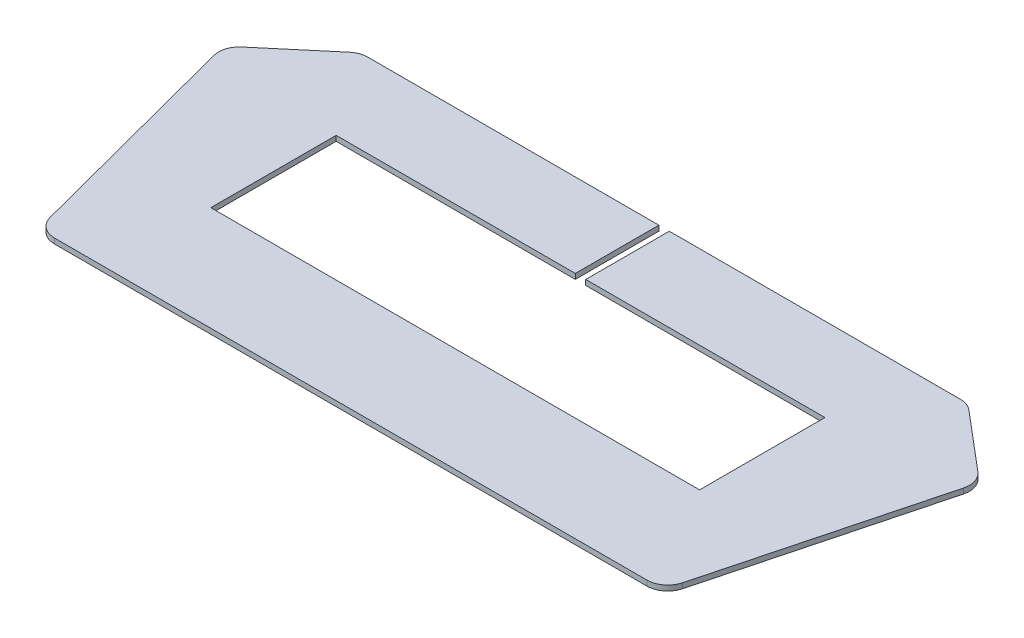
from build123d import *

# Parameters (mm, degrees)
BASE_FLANGE1_DEPTH = 0.25


# Sheet-metal steps are written as plain solids
with BuildPart() as part:
    # Sketch1 → Base-Flange1 (new body)
    with BuildSketch(Plane(origin=(0, 0, 0), x_dir=(1, 0, 0), z_dir=(0, 1, 0))):
        with BuildLine():
            Line((-14.178620776, -8), (14.178620776, -8))
            ThreePointArc((14.178620776, -8), (14.789399734, -7.791801152), (15.145851741, -7.253898128))
            Line((15.145851741, -7.253898128), (17.939776994, 3.389626646))
            ThreePointArc((17.939776994, 3.389626646), (17.926022481, 3.944992277), (17.618005902, 4.407318956))
            Line((17.618005902, 4.407318956), (14.829510217, 6.763794182))
            ThreePointArc((14.829510217, 6.763794182), (14.527711383, 6.939093761), (14.184050345, 7))
            Line((14.184050345, 7), (0.25, 7))
            Line((0.25, 7), (0.25, 3))
            Line((0.25, 3), (11.7, 3))
            Line((11.7, 3), (11.7, -3))
            Line((11.7, -3), (-11.7, -3))
            Line((-11.7, -3), (-11.7, 3))
            Line((-11.7, 3), (-0.25, 3))
            Line((-0.25, 3), (-0.25, 7))
            Line((-0.25, 7), (-14.184050345, 7))
            ThreePointArc((-14.184050345, 7), (-14.527711383, 6.939093761), (-14.829510217, 6.763794182))
            Line((-14.829510217, 6.763794182), (-17.618005902, 4.407318956))
            ThreePointArc((-17.618005902, 4.407318956), (-17.926022481, 3.944992277), (-17.939776994, 3.389626646))
            Line((-17.939776994, 3.389626646), (-15.145851741, -7.253898128))
            ThreePointArc((-15.145851741, -7.253898128), (-14.789399734, -7.791801152), (-14.178620776, -8))
        make_face()
    extrude(amount=-BASE_FLANGE1_DEPTH)


solid = part.part
